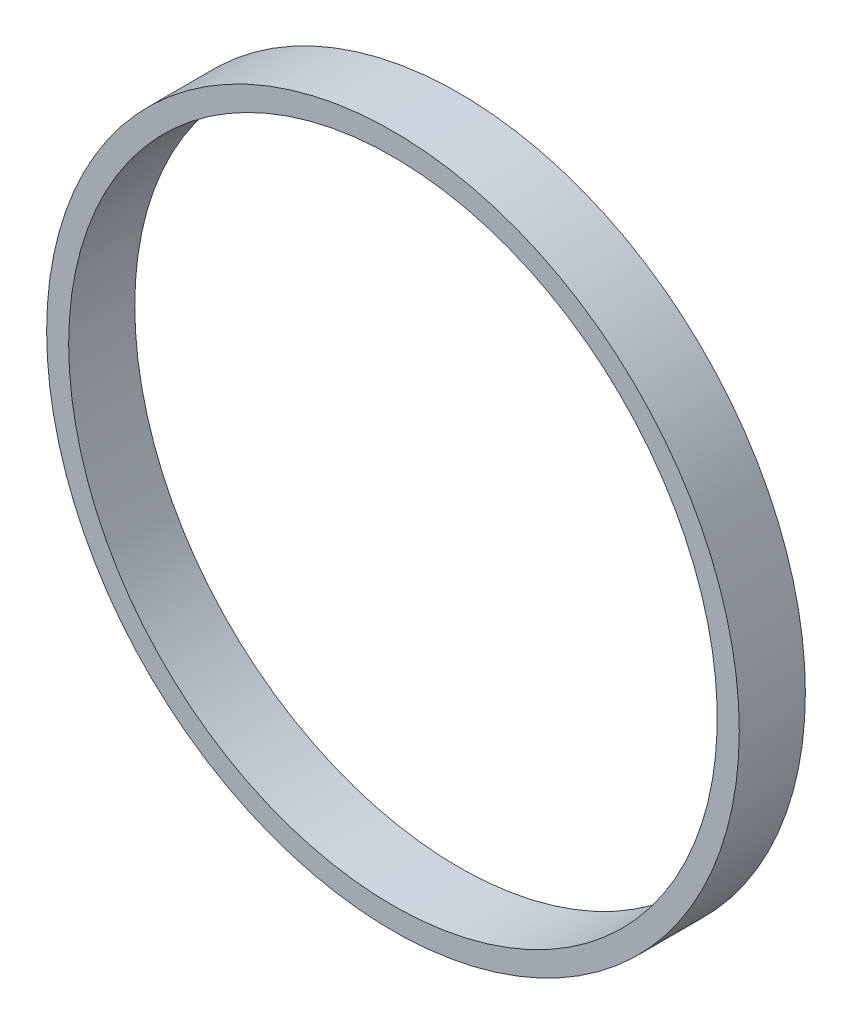
from build123d import *

# Parameters (mm, degrees)
SKETCH1_R           = 24.9555
SKETCH1_R_2         = 23.368
BOSS_EXTRUDE1_DEPTH = 4.7625


with BuildPart() as part:
    # Sketch1 → Boss-Extrude1 (new body)
    with BuildSketch(Plane.XY):
        Circle(SKETCH1_R)
        Circle(SKETCH1_R_2, mode=Mode.SUBTRACT)
    extrude(amount=BOSS_EXTRUDE1_DEPTH)


solid = part.part
